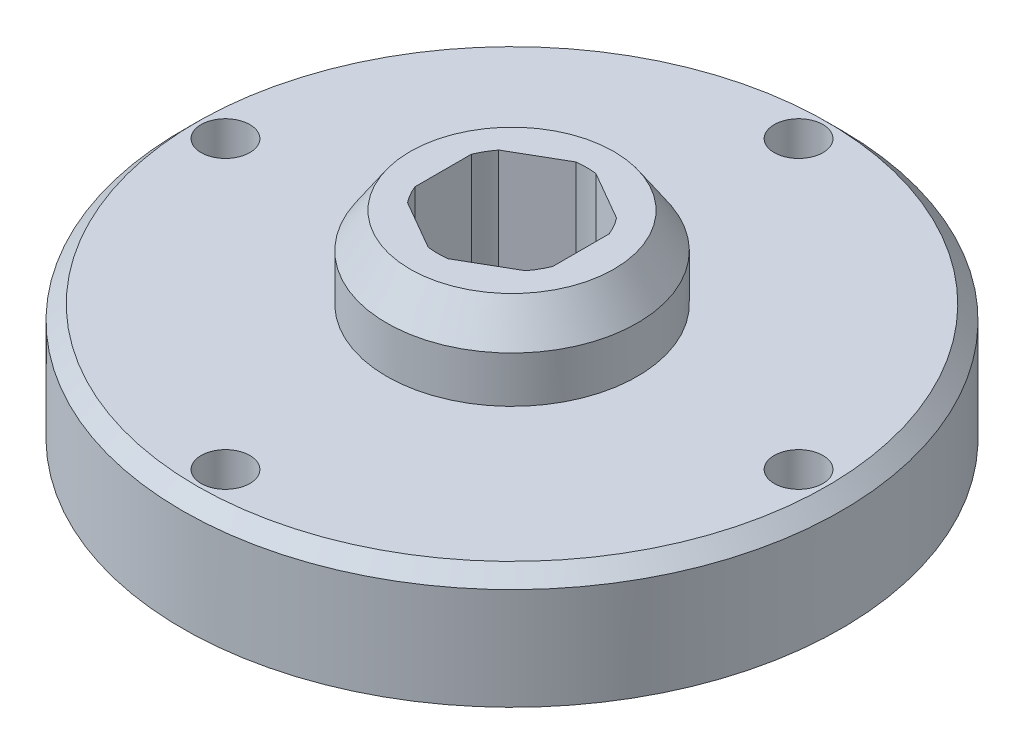
from build123d import *

# Parameters (mm, degrees)
M3_CLEARANCE_HOLE1_D   = 3.4
CIRPATTERN1_COUNT      = 4
BOSS_EXTRUDE1_START    = -8.82278
BOSS_EXTRUDE1_DEPTH    = 8.82278
CHAMFER1_SIZE          = 0.75
CHAMFER2_SIZE          = 1
MOVE_START             = 8.11328
MOVE_FACE1_OUTLINE_R   = 8.9
MOVE_FACE1_OUTLINE_R_2 = 8.75
MOVE_FACE1_DEPTH       = 3.223364194


# Read off the part's stored shape, not the designer's step: Move Face1
with BuildPart() as part:
    # Sketch1 → Revolve1 (revolve)
    with BuildSketch(Plane.XY, mode=Mode.PRIVATE) as revolve1_sk:
        Polygon((6.8, 0), (6.8, 4.953), (5.2, 4.953), (5.2, 13.77578), (7.112, 13.77578), (8.9, 11.11328), (8.9, 8.11328), (23, 8.11328), (23, 0), align=None)
    revolve(revolve1_sk.sketch.rotate(Axis((0, 0, 0), (0, 1, 0)), 90), axis=Axis((0, 0, 0), (0, 1, 0)))

    # M3 Clearance Hole1 (through all)
    with Locations(Plane.XZ):
        with Locations((-20, 0)):
            m3_clearance_hole1 = Hole(M3_CLEARANCE_HOLE1_D / 2)

    # CirPattern1: M3 Clearance Hole1 ×4 about axis
    cirpattern1_axis = Axis((0, 0, 0), (0, 1, 0))
    for i in range(1, CIRPATTERN1_COUNT):
        add(m3_clearance_hole1.rotate(cirpattern1_axis, i * 360 / CIRPATTERN1_COUNT), mode=Mode.SUBTRACT)

    # Sketch4 → Boss-Extrude1 (add)
    with BuildSketch(Plane.XZ.offset(-4.953).offset(BOSS_EXTRUDE1_START)):
        with BuildLine():
            Line((0.700412138, 5.152613205), (4.112087862, 3.182881307))
            ThreePointArc((4.112087862, 3.182881307), (2.6, 4.5033321), (0.700412138, 5.152613205))
        make_face()
        with BuildLine():
            ThreePointArc((4.8125, -1.969731898), (5.2, 0), (4.8125, 1.969731898))
            Line((4.8125, 1.969731898), (4.8125, -1.969731898))
        make_face()
        with BuildLine():
            Line((-4.112087862, 3.182881307), (-0.700412138, 5.152613205))
            ThreePointArc((-0.700412138, 5.152613205), (-2.6, 4.5033321), (-4.112087862, 3.182881307))
        make_face()
        with BuildLine():
            ThreePointArc((0.700412138, -5.152613205), (2.6, -4.5033321), (4.112087862, -3.182881307))
            Line((4.112087862, -3.182881307), (0.700412138, -5.152613205))
        make_face()
        with BuildLine():
            Line((-4.8125, -1.969731898), (-4.8125, 1.969731898))
            ThreePointArc((-4.8125, 1.969731898), (-5.2, 0), (-4.8125, -1.969731898))
        make_face()
        with BuildLine():
            ThreePointArc((-4.112087862, -3.182881307), (-2.6, -4.5033321), (-0.700412138, -5.152613205))
            Line((-0.700412138, -5.152613205), (-4.112087862, -3.182881307))
        make_face()
    extrude(amount=BOSS_EXTRUDE1_DEPTH)

    # Chamfer1
    chamfer1_edges = [part.edges().sort_by_distance(p)[0] for p in [
        (0, 0, 6.8),
    ]]
    chamfer(chamfer1_edges, length=CHAMFER1_SIZE)

    # Chamfer2
    chamfer2_edges = [part.edges().sort_by_distance(p)[0] for p in [
        (0, 8.11328, 23),
    ]]
    chamfer(chamfer2_edges, length=CHAMFER2_SIZE)

    # Move Face1 outline → Move Face1 (cut)
    with BuildSketch(Plane(origin=(0, 0, 0), x_dir=(1, 0, 0), z_dir=(0, 1, 0)).offset(MOVE_START)):
        Circle(MOVE_FACE1_OUTLINE_R)
        Circle(MOVE_FACE1_OUTLINE_R_2, mode=Mode.SUBTRACT)
    extrude(amount=MOVE_FACE1_DEPTH, mode=Mode.SUBTRACT)


solid = part.part
